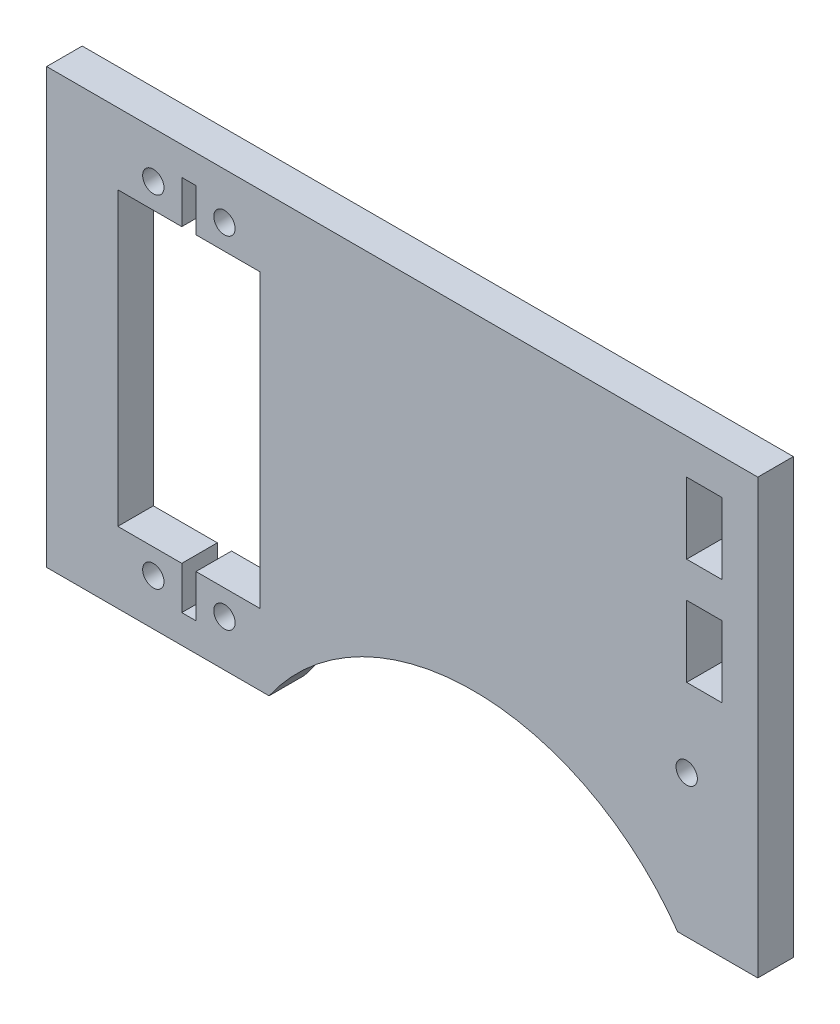
from build123d import *

# Parameters (mm, degrees)
ESQUISSE1_R        = 1.5
ESQUISSE1_W        = 5
ESQUISSE1_H        = 10
BOSS_EXTRU_1_DEPTH = 5


with BuildPart() as part:
    # Esquisse1 → Boss.-Extru.1 (new body)
    with BuildSketch(Plane.XY):
        with BuildLine():
            Line((0, 0), (31.277186767, 0))
            ThreePointArc((31.277186767, 0), (60, 15), (88.722813233, 0))
            Line((88.722813233, 0), (100, 0))
            Line((100, 0), (100, 61))
            Line((100, 61), (0, 61))
            Line((0, 61), (0, 0))
        make_face()
        with Locations((15, 6.5)):
            Circle(ESQUISSE1_R, mode=Mode.SUBTRACT)
        with Locations((25, 6.5)):
            Circle(ESQUISSE1_R, mode=Mode.SUBTRACT)
        with Locations((25, 54.5)):
            Circle(ESQUISSE1_R, mode=Mode.SUBTRACT)
        with Locations((15, 54.5)):
            Circle(ESQUISSE1_R, mode=Mode.SUBTRACT)
        with Locations((90, 20)):
            Circle(ESQUISSE1_R, mode=Mode.SUBTRACT)
        Polygon((10, 51), (19, 51), (19, 57), (21, 57), (21, 51), (30, 51), (30, 10), (21, 10), (21, 4), (19, 4), (19, 10), (10, 10), align=None, mode=Mode.SUBTRACT)
        with Locations((92.5, 51)):
            Rectangle(ESQUISSE1_W, ESQUISSE1_H, mode=Mode.SUBTRACT)
        with Locations((92.5, 36)):
            Rectangle(ESQUISSE1_W, ESQUISSE1_H, mode=Mode.SUBTRACT)
    extrude(amount=BOSS_EXTRU_1_DEPTH)


solid = part.part
